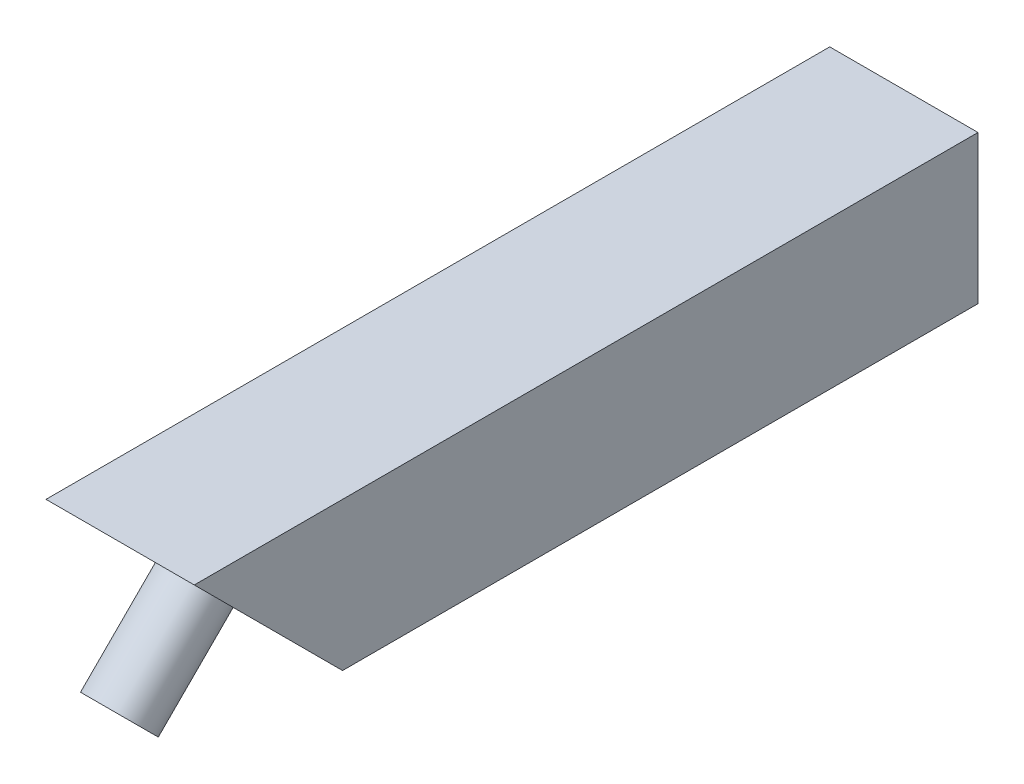
from build123d import *

# Parameters (mm, degrees)
SKETCH1_W           = 7
SKETCH1_H           = 7
BOSS_EXTRUDE1_DEPTH = 20
BOSS_EXTRUDE2_DEPTH = 7
SKETCH4_R           = 1.5
BOSS_EXTRUDE3_DEPTH = 5
SKETCH5_W           = 7
SKETCH5_H           = 7
BOSS_EXTRUDE4_DEPTH = 10


with BuildPart() as part:
    # Sketch1 → Boss-Extrude1 (new body)
    with BuildSketch(Plane.XY):
        with Locations((3.5, 3.5)):
            Rectangle(SKETCH1_W, SKETCH1_H)
    extrude(amount=BOSS_EXTRUDE1_DEPTH)

    # Sketch3 → Boss-Extrude2 (add)
    with BuildSketch(Plane(origin=(7, 0, 0), x_dir=(0, 0, -1), z_dir=(1, 0, 0))):
        Polygon((-20, 7), (-27, 7), (-20, 0), align=None)
    extrude(amount=-BOSS_EXTRUDE2_DEPTH)

    # Sketch4 → Boss-Extrude3 (add)
    with BuildSketch(Plane(origin=(0, -10, 10), x_dir=(1, 0, 0), z_dir=(0, -0.7071067811865477, 0.7071067811865475))):
        with Locations((3.5, 19.091883092)):
            Circle(SKETCH4_R)
    extrude(amount=BOSS_EXTRUDE3_DEPTH)

    # Sketch5 → Boss-Extrude4 (add)
    with BuildSketch(Plane(origin=(0, 0, 0), x_dir=(-1, 0, 0), z_dir=(0, 0, -1))):
        with Locations((-3.5, 3.5)):
            Rectangle(SKETCH5_W, SKETCH5_H)
    extrude(amount=BOSS_EXTRUDE4_DEPTH)


solid = part.part
